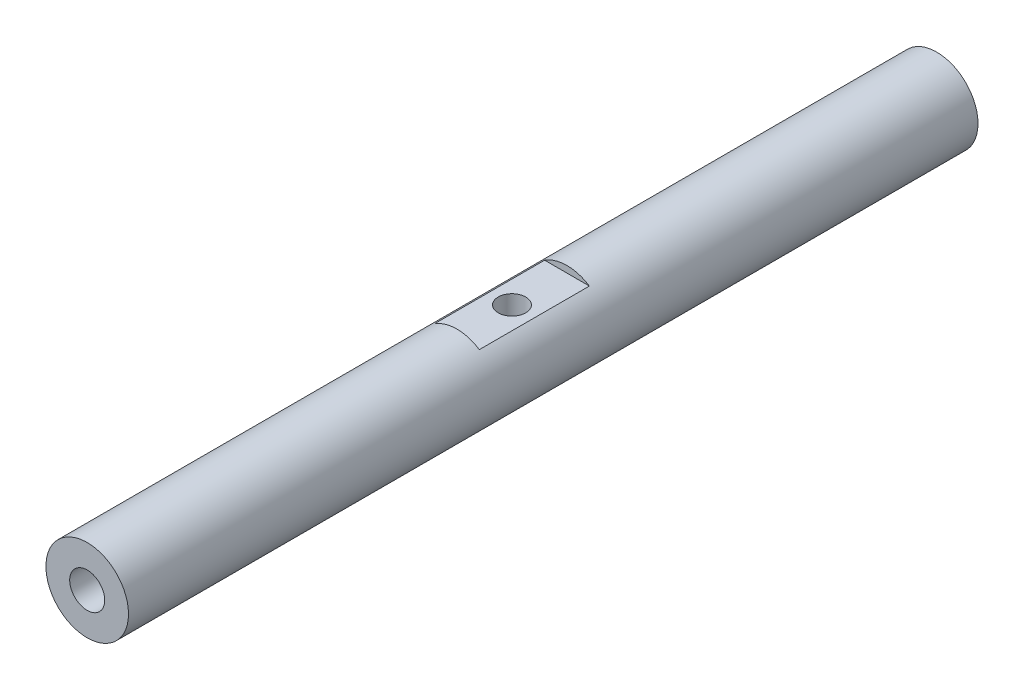
from build123d import *

# Parameters (mm, degrees)
SKETCH1_R           = 4.7625
BOSS_EXTRUDE1_DEPTH = 49.000000044
SKETCH4_W           = 12.7
SKETCH4_H           = 12.7
CUT_EXTRUDE1_DEPTH  = 0.762
SKETCH5_R           = 1.5875
CUT_EXTRUDE2_DEPTH  = 51.004715573


# Read off the part's stored shape, not the designer's step: #10-32 Tapped Hole1
with BuildPart() as part:
    # Sketch1 → Boss-Extrude1 (new, symmetric)
    with BuildSketch(Plane.XY):
        Circle(SKETCH1_R)
    extrude(amount=BOSS_EXTRUDE1_DEPTH, both=True)

    # #10-32 Tapped Hole1 outline → #10-32 Tapped Hole1 (revolve, cut)
    with BuildSketch(Plane.XZ):
        Polygon((2.0193, -36.970560044), (0, -35.757242196), (0, -49.000000044), (2.0193, -49.000000044), align=None)
        Polygon((0, 49.000000044), (0, 35.757242196), (2.0193, 36.970560044), (2.0193, 49.000000044), align=None)
    revolve(axis=Axis((0, 0, 0), (0, 0, 1)), mode=Mode.SUBTRACT)

    # Sketch4 → Cut-Extrude1 (cut)
    with BuildSketch(Plane(origin=(0, 4.7625, 0), x_dir=(1, 0, 0), z_dir=(0, 1, 0))):
        Rectangle(SKETCH4_W, SKETCH4_H)
    cut_extrude1 = extrude(amount=-CUT_EXTRUDE1_DEPTH, mode=Mode.SUBTRACT)

    # Sketch5 → Cut-Extrude2 (cut, through all)
    with BuildSketch(Plane(origin=(0, 4.0005, 0), x_dir=(1, 0, 0), z_dir=(0, 1, 0))):
        with Locations(Location((0, 0, 0), (0, 0, 270))):
            Circle(SKETCH5_R)
    extrude(amount=-CUT_EXTRUDE2_DEPTH, mode=Mode.SUBTRACT)

    # Mirror1: Cut-Extrude1 across plane
    add(cut_extrude1.mirror(Plane.ZX), mode=Mode.SUBTRACT)


solid = part.part
